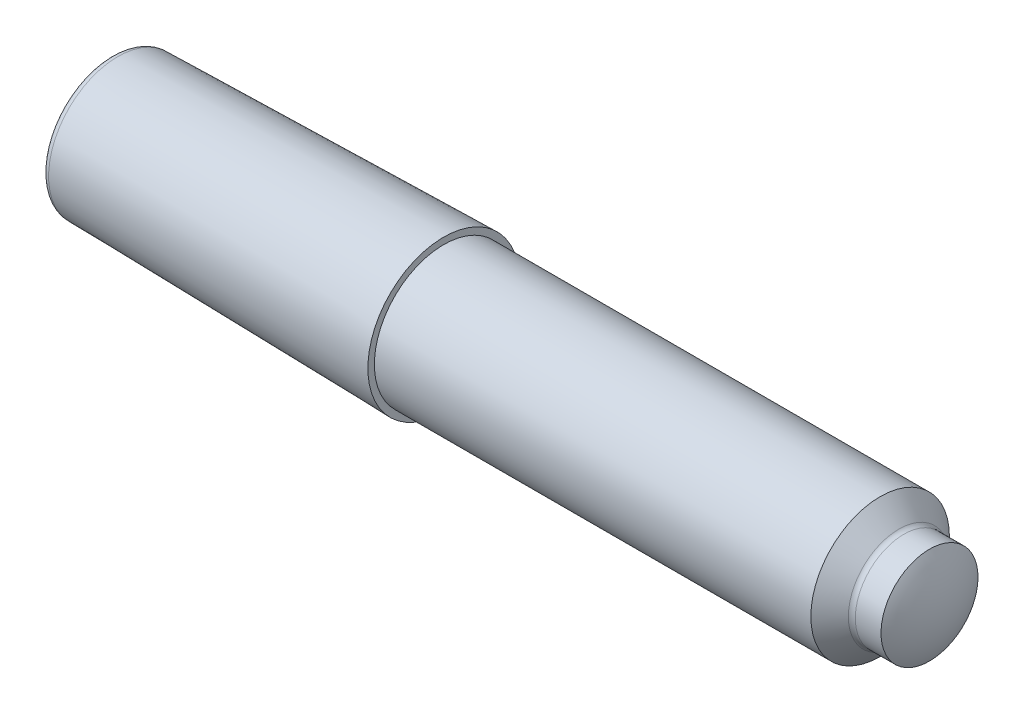
from build123d import *

# Parameters (mm, degrees)
FILLET1_R = 0.25


with BuildPart() as part:
    # Sketch1 → Body (revolve)
    with BuildSketch(Plane.XY):
        with BuildLine():
            Line((0, 0), (0, 2.250049985))
            ThreePointArc((0, 2.250049985), (0.071464639, 2.425050342), (0.245001, 2.5))
            Line((0.245001, 2.5), (12, 2.73509998))
            Line((12, 2.73509998), (12, 2.5))
            Line((12, 2.5), (14.4, 2.5))
            Line((14.4, 2.5), (27.75, 2.5))
            Line((27.75, 2.5), (28.5, 1.75))
            Line((28.5, 1.75), (29.531088913, 1.75))
            ThreePointArc((29.531088913, 1.75), (29.880740392, 0.905866658), (30, 0))
            Line((30, 0), (0, 0))
        make_face()
    revolve(axis=Axis((0, 0, 0), (-1, 0, 0)))

    # Fillet1
    fillet1_edges = [part.edges().sort_by_distance(p)[0] for p in [
        (28.5, -1.75, 0),
    ]]
    fillet(fillet1_edges, radius=FILLET1_R)


solid = part.part
